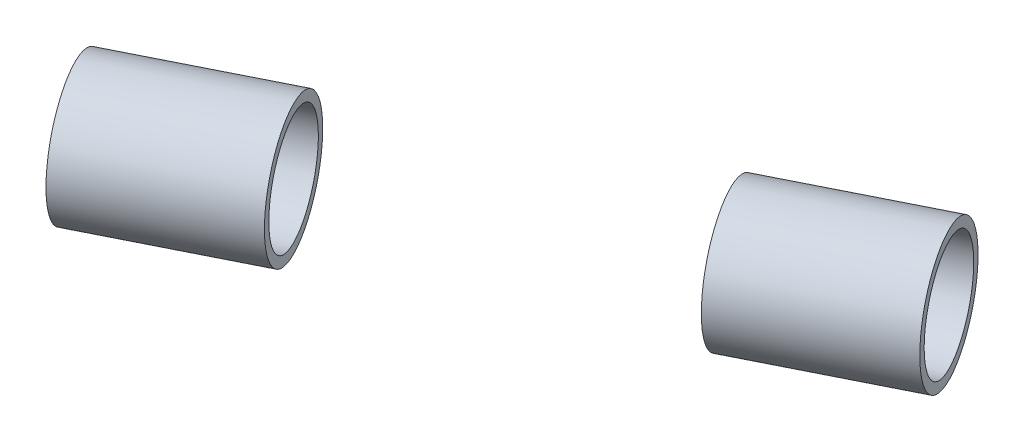
from build123d import *

# Parameters (mm, degrees)
SZKIC4_R                   = 17
WYTNIJ_WYCI_GNI_CIE1_DEPTH = 298.489495613


with BuildPart() as part:
    # Szkic2 → Obrót1 (revolve)
    with BuildSketch(Plane(origin=(0, 0, 0), x_dir=(1, 0, 0), z_dir=(0, 1, 0))):
        Polygon((13.416407865, -138.636214605), (-31.304951685, -160.99689438), (-22.360679775, -178.8854382), (22.360679775, -156.524758425), align=None)
    revolve(axis=Axis((0, 0, 167.705098312), (0.894427190999916, 0, -0.44721359549995787)))


with BuildPart() as body_2:
    # Szkic3 → Obrót2 (revolve)
    with BuildSketch(Plane(origin=(0, 0, 0), x_dir=(1, 0, 0), z_dir=(0, 1, 0))):
        Polygon((111.803398875, -111.803398875), (102.859126965, -93.914855055), (147.580486515, -71.55417528), (156.524758425, -89.4427191), align=None)
    revolve(axis=Axis((0, 0, 167.705098312), (0.894427190999916, 0, -0.44721359549995787)))


with BuildPart() as wytnij_wyci_gni_cie1_tool:
    # Szkic4 → Wytnij-wyciągnięcie1 (new, through all)
    with BuildSketch(Plane(origin=(-89.4427191, 0, 44.72135955), x_dir=(0.44721359549995787, 0, 0.894427190999916), z_dir=(-0.894427190999916, 0, 0.44721359549995787))):
        with Locations((150, 0)):
            Circle(SZKIC4_R)
    extrude(amount=-WYTNIJ_WYCI_GNI_CIE1_DEPTH)


with BuildPart() as part_1:
    add(part.part)

    # Wytnij-wyciągnięcie1: cut by wytnij_wyci_gni_cie1_tool
    add(wytnij_wyci_gni_cie1_tool.part, mode=Mode.SUBTRACT)


with BuildPart() as body_2_1:
    add(body_2.part)

    # Wytnij-wyciągnięcie1: cut by wytnij_wyci_gni_cie1_tool
    add(wytnij_wyci_gni_cie1_tool.part, mode=Mode.SUBTRACT)


solid = Compound([part_1.part, body_2_1.part])
